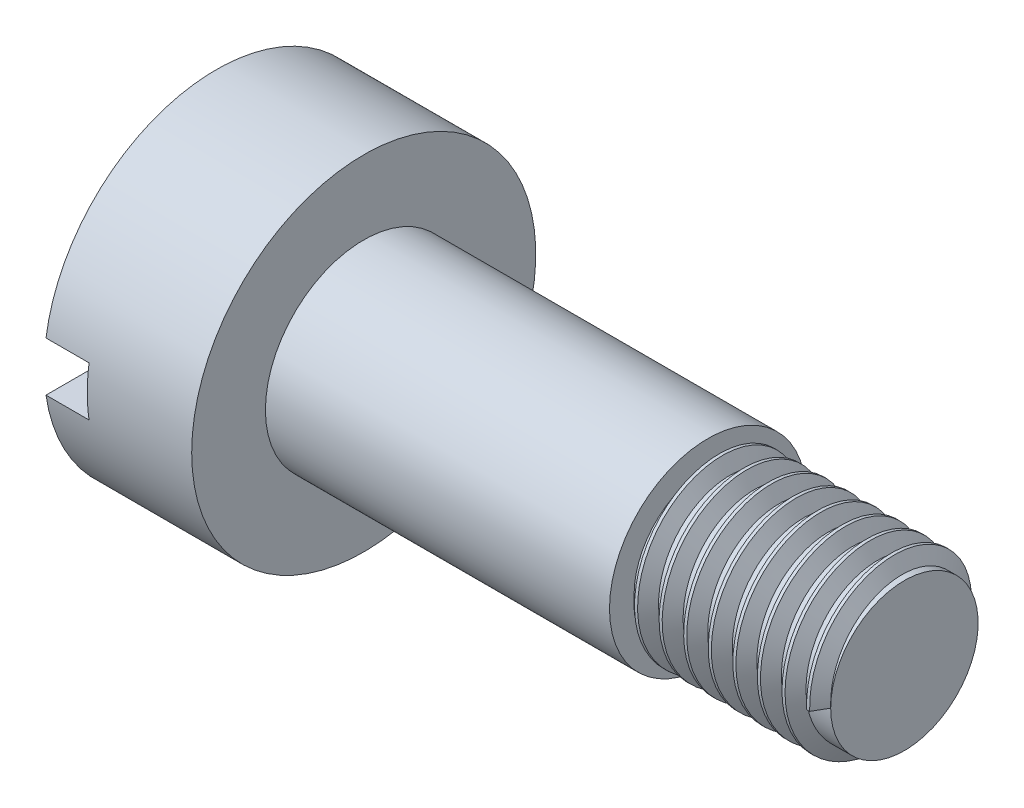
from build123d import *

# Parameters (mm, degrees)
CUT_EXTRUDE1_DEPTH      = 9.5732141
CUT_EXTRUDE1_DEPTH_BACK = 9.5732141
SKETCH2_W               = 1.751196172
SKETCH2_H               = 1.00594041
THREAD1_PITCH           = 0.5


with BuildPart() as part:
    # Sketch1 → Revolve1 (revolve)
    with BuildSketch(Plane.XY, mode=Mode.PRIVATE) as revolve1_sk:
        Polygon((-7, 0), (7, 0), (7, 1.5), (3, 1.5), (3, 2), (-4, 2), (-4, 3.5), (-7, 3.5), align=None)
    revolve(revolve1_sk.sketch.rotate(Axis((-7, 0, 0), (1, 0, 0)), 90), axis=Axis((-7, 0, 0), (1, 0, 0)))

    # Sketch2 → Cut-Extrude1 (cut, two sides: drawn at the far end of the back side and taken through both)
    with BuildSketch(Plane.XY.offset(-CUT_EXTRUDE1_DEPTH_BACK)):
        with Locations((-7, 0)):
            Rectangle(SKETCH2_W, SKETCH2_H)
    extrude(amount=CUT_EXTRUDE1_DEPTH + CUT_EXTRUDE1_DEPTH_BACK, mode=Mode.SUBTRACT)

    # Thread1: the profile of Thread Profile1 profile screwed along a right-hand helix of 8 turns, 6 arcs to a turn; built about Z, then put on its axis
    thread1_z = Axis((0, 0, 0), (0, 0, 1))
    thread1_corners = [(1.4997, 0, -0.000173205), (1.770632938, 0, 0.156249999), (1.770632937, 0, 0.218749999), (1.4997, 0, 0.375173204)]
    with BuildLine(mode=Mode.PRIVATE) as thread1_profile:
        Line(thread1_corners[0], thread1_corners[1])
        Line(thread1_corners[1], thread1_corners[2])
        Line(thread1_corners[2], thread1_corners[3])
        Line(thread1_corners[3], thread1_corners[0])
    thread1_cap = Face(thread1_profile.wire())
    thread1_turn_angles = [0, 30, 60, 90, 120, 150, 180, 210, 240, 270, 300, 330, 360]
    thread1_turn_weights = [1, 0.8660254037844387, 1, 0.8660254037844387, 1, 0.8660254037844387, 1, 0.8660254037844387, 1, 0.8660254037844387, 1, 0.8660254037844387, 1]
    thread1_turn_rails = [Edge.make_bspline([Vector(p[0], p[1], 0).rotate(thread1_z, thread1_turn_angles[k]) / thread1_turn_weights[k] + Vector(0, 0, p[2] + THREAD1_PITCH * thread1_turn_angles[k] / 360) for k in range(13)], [0, 0, 0, 1, 1, 2, 2, 3, 3, 4, 4, 5, 5, 6, 6, 6], 2, thread1_turn_weights) for p in thread1_corners]
    thread1_turn_sides = [Face.make_surface_from_curves(thread1_turn_rails[p[0]], thread1_turn_rails[p[1]]) for p in [(0, 1), (1, 2), (2, 3), (3, 0)]]
    thread1 = Plane(origin=(7, 0, 0), x_dir=(0, 0, 1), z_dir=(-1, 0, 0)) * Solid(Shell([*[p.moved(Location((0, 0, THREAD1_PITCH * i))) for i in range(8) for p in thread1_turn_sides], thread1_cap, thread1_cap.rotate(thread1_z, 2880).moved(Location((0, 0, THREAD1_PITCH * 2880 / 360)))]))
    add(thread1)


solid = part.part
